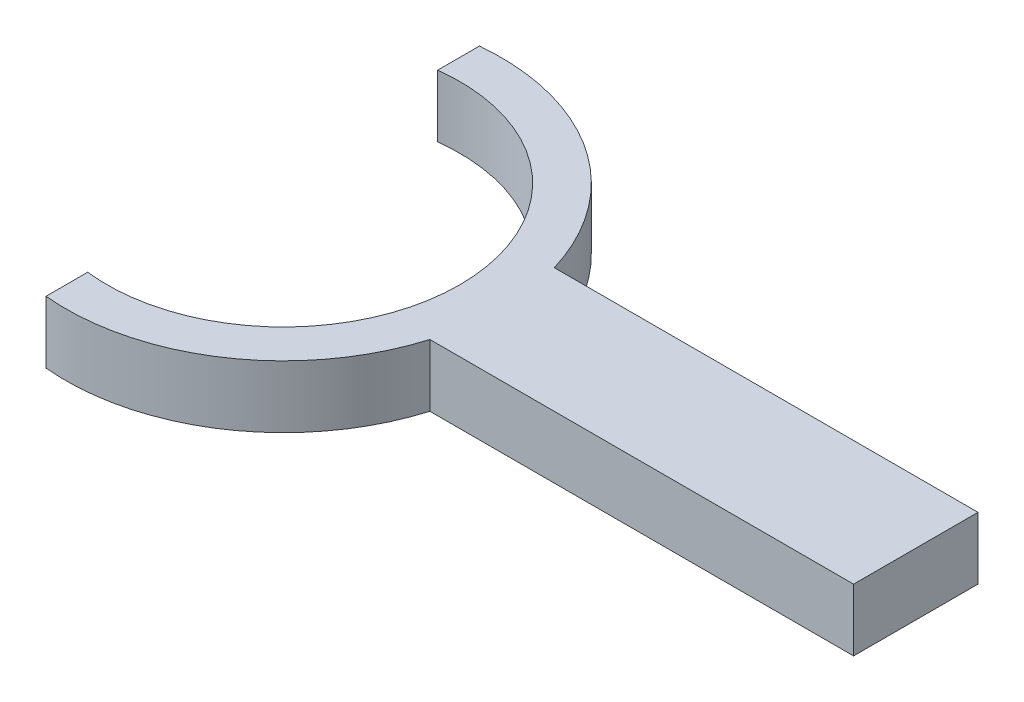
from build123d import *

# Parameters (mm, degrees)
SKETCH_1_R           = 5.25
SKETCH_1_R_2         = 4.25
EXTRUDE_1_DEPTH      = 1.5
EXTRUDE_2_DEPTH      = 10
EXTRUDE_2_DEPTH_BACK = 0.5
SKETCH_2_W           = 3
SKETCH_2_H           = 1.5
CUT_EXTRUDE_1_REACH  = 18.198
SKETCH_3_W           = 6.461960394
SKETCH_3_H           = 12.103620116


with BuildPart() as part:
    # 草图1 → 凸台-拉伸1 (new body)
    with BuildSketch(Plane(origin=(0, 0, 0), x_dir=(1, 0, 0), z_dir=(0, 1, 0))):
        Circle(SKETCH_1_R)
        Circle(SKETCH_1_R_2, mode=Mode.SUBTRACT)
    extrude(amount=EXTRUDE_1_DEPTH)

    # 草图2 → 凸台-拉伸2 (add, two sides: drawn at the far end of the back side and taken through both)
    with BuildSketch(Plane(origin=(5.25, 0, 0), x_dir=(0, 0, -1), z_dir=(1, 0, 0)).offset(-EXTRUDE_2_DEPTH_BACK)):
        with Locations((0, 0.75)):
            Rectangle(SKETCH_2_W, SKETCH_2_H)
    extrude(amount=EXTRUDE_2_DEPTH + EXTRUDE_2_DEPTH_BACK)

    # 草图3 → 切除-拉伸1 (cut, up to next)
    with BuildSketch(Plane(origin=(0, 1.5, 0), x_dir=(1, 0, 0), z_dir=(0, 1, 0)), mode=Mode.PRIVATE) as cut_extrude_1_sk1:
        with Locations((-3.730980197, -0.117122599)):
            Rectangle(SKETCH_3_W, SKETCH_3_H)
    cut_extrude_1_tool1 = extrude(cut_extrude_1_sk1.sketch, amount=-CUT_EXTRUDE_1_REACH, mode=Mode.PRIVATE) & part.part
    add(cut_extrude_1_tool1.solids().sort_by_distance((-3.73098, 1.5, 0.117123))[0], mode=Mode.SUBTRACT)


solid = part.part
